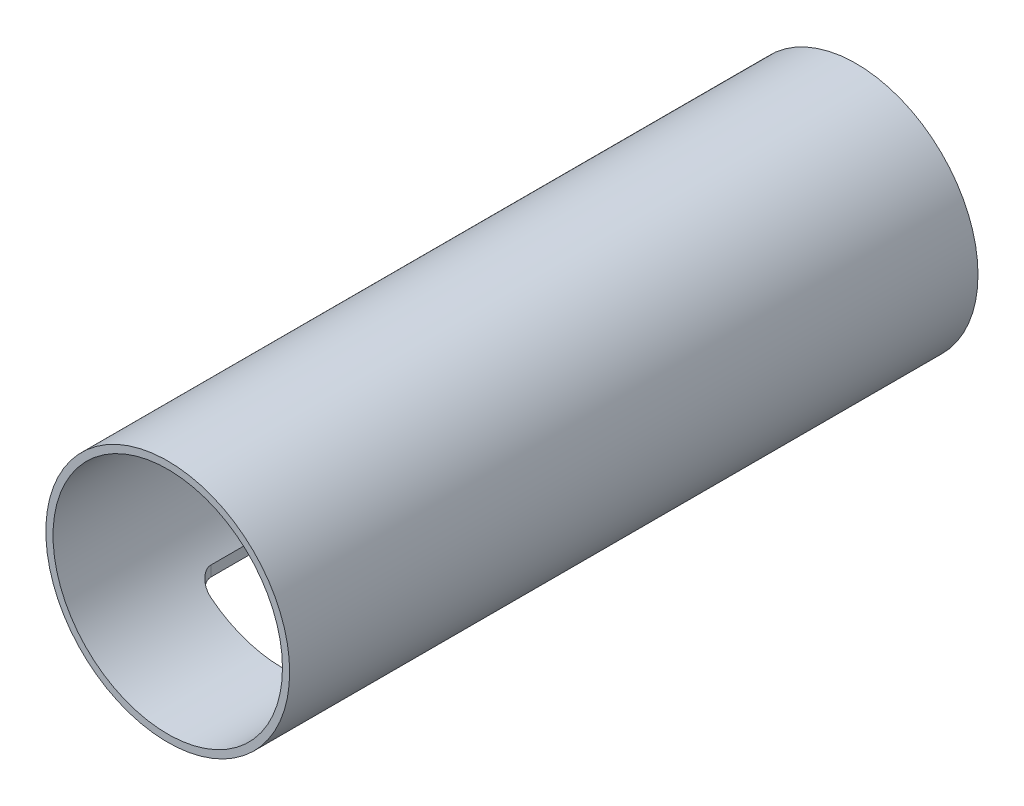
from build123d import *

# Parameters (mm, degrees)
SKETCH1_R      = 53.975
SKETCH1_R_2    = 50.8
EXTRUDE1_DEPTH = 304.8
SKETCH2_W      = 76.2
SKETCH2_H      = 203.2
EXTRUDE2_DEPTH = 315.212732476
FILLET1_R      = 6.35


with BuildPart() as part:
    # Sketch1 → Extrude1 (new body)
    with BuildSketch(Plane.XY):
        with Locations(Location((0, 0, 0), (0, 0, 180))):
            Circle(SKETCH1_R)
        with Locations(Location((0, 0, 0), (0, 0, 180))):
            Circle(SKETCH1_R_2, mode=Mode.SUBTRACT)
    extrude(amount=EXTRUDE1_DEPTH)

    # Sketch2 → Extrude2 (cut, through all)
    with BuildSketch(Plane(origin=(0, 0, 0), x_dir=(1, 0, 0), z_dir=(0, 1, 0))):
        with Locations((0, -152.4)):
            Rectangle(SKETCH2_W, SKETCH2_H)
    extrude(amount=-EXTRUDE2_DEPTH, mode=Mode.SUBTRACT)

    # Fillet1
    # the kernel refuses this fillet: 6.35 mm, written as the material it adds along each edge
    with BuildSketch(Plane(origin=(-38.1, -17.726041651, 254), x_dir=(0, 0, -1), z_dir=(0, -1, 0))) as fillet1_piece_1_section:
        with BuildLine():
            CenterArc((FILLET1_R, FILLET1_R), FILLET1_R, 180, 90)
            Line((0, FILLET1_R), (0, 0))
            Line((0, 0), (FILLET1_R, 0))
        make_face()
    fillet1_piece_1 = extrude(amount=36.381021137, mode=Mode.PRIVATE)
    fillet1_piece_1 = fillet1_piece_1 & Plane(origin=(0, 0, 252.560306593), x_dir=(-1, 0, 0), z_dir=(0, 0, -1)) * Cylinder(53.975, 99, mode=Mode.PRIVATE)
    fillet1_piece_1 = fillet1_piece_1 - Plane(origin=(0, 0, 252.560306593), x_dir=(-1, 0, 0), z_dir=(0, 0, -1)) * Cylinder(50.8, 99, mode=Mode.PRIVATE)
    add(fillet1_piece_1)
    with BuildSketch(Plane(origin=(-38.1, -17.726041651, 50.8), x_dir=(1, 0, 0), z_dir=(0, -1, 0))) as fillet1_piece_2_section:
        with BuildLine():
            CenterArc((FILLET1_R, FILLET1_R), FILLET1_R, 180, 90)
            Line((0, FILLET1_R), (0, 0))
            Line((0, 0), (FILLET1_R, 0))
        make_face()
    fillet1_piece_2 = extrude(amount=36.381021137, mode=Mode.PRIVATE)
    fillet1_piece_2 = fillet1_piece_2 & Plane(origin=(0, 0, 52.23969466), x_dir=(-1, 0, 0), z_dir=(0, 0, -1)) * Cylinder(53.975, 99, mode=Mode.PRIVATE)
    fillet1_piece_2 = fillet1_piece_2 - Plane(origin=(0, 0, 52.23969466), x_dir=(-1, 0, 0), z_dir=(0, 0, -1)) * Cylinder(50.8, 99, mode=Mode.PRIVATE)
    add(fillet1_piece_2)
    with BuildSketch(Plane(origin=(38.1, -17.726041651, 50.8), x_dir=(-1, 0, 0), z_dir=(0, -1, 0))) as fillet1_piece_3_section:
        with BuildLine():
            CenterArc((FILLET1_R, -FILLET1_R), FILLET1_R, 90, 90)
            Line((0, -FILLET1_R), (0, 0))
            Line((0, 0), (FILLET1_R, 0))
        make_face()
    fillet1_piece_3 = extrude(amount=36.381021137, mode=Mode.PRIVATE)
    fillet1_piece_3 = fillet1_piece_3 & Plane(origin=(0, 0, 52.239693302), x_dir=(-1, 0, 0), z_dir=(0, 0, -1)) * Cylinder(53.975, 99, mode=Mode.PRIVATE)
    fillet1_piece_3 = fillet1_piece_3 - Plane(origin=(0, 0, 52.239693302), x_dir=(-1, 0, 0), z_dir=(0, 0, -1)) * Cylinder(50.8, 99, mode=Mode.PRIVATE)
    add(fillet1_piece_3)
    with BuildSketch(Plane(origin=(38.1, -17.726041651, 254), x_dir=(-1, 0, 0), z_dir=(0, -1, 0))) as fillet1_piece_4_section:
        with BuildLine():
            CenterArc((FILLET1_R, FILLET1_R), FILLET1_R, 180, 90)
            Line((0, FILLET1_R), (0, 0))
            Line((0, 0), (FILLET1_R, 0))
        make_face()
    fillet1_piece_4 = extrude(amount=36.381021137, mode=Mode.PRIVATE)
    fillet1_piece_4 = fillet1_piece_4 & Plane(origin=(0, 0, 252.560306698), x_dir=(-1, 0, 0), z_dir=(0, 0, -1)) * Cylinder(53.975, 99, mode=Mode.PRIVATE)
    fillet1_piece_4 = fillet1_piece_4 - Plane(origin=(0, 0, 252.560306698), x_dir=(-1, 0, 0), z_dir=(0, 0, -1)) * Cylinder(50.8, 99, mode=Mode.PRIVATE)
    add(fillet1_piece_4)


solid = part.part
